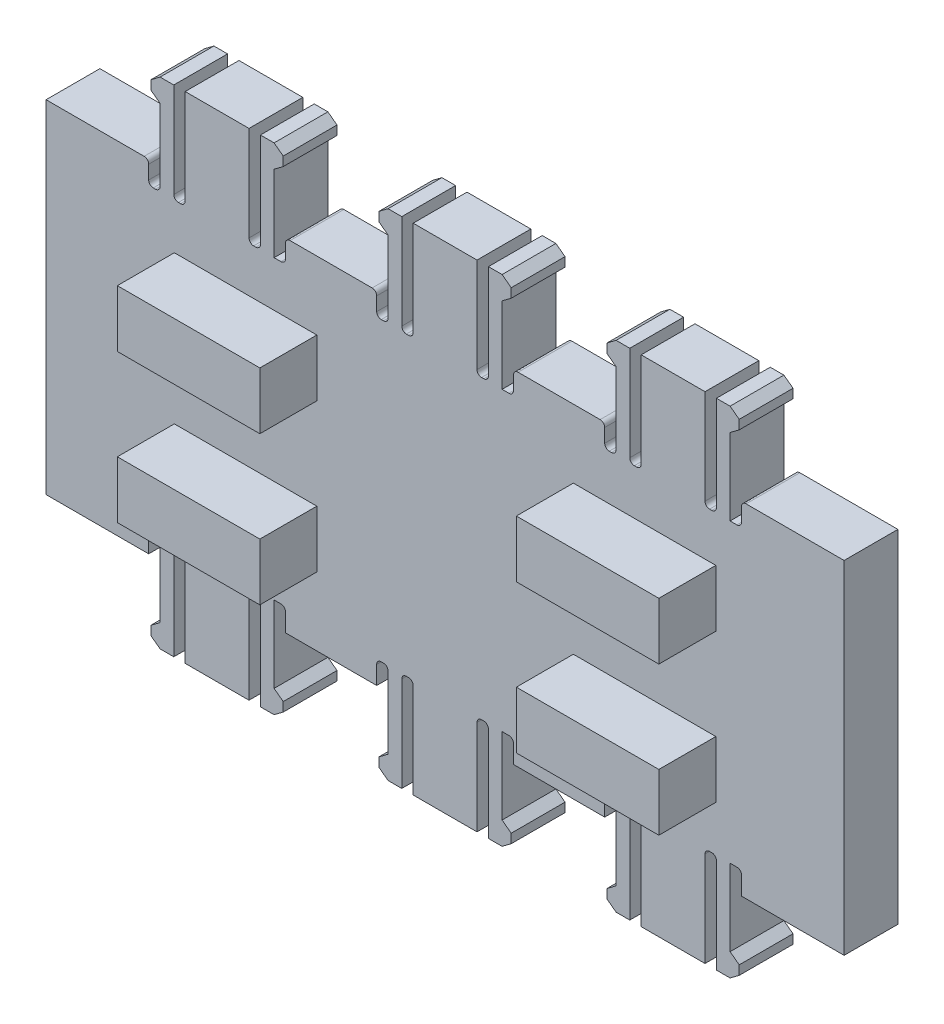
from build123d import *

# Parameters (mm, degrees)
SKETCH1_W                                    = 44.45
SKETCH1_H                                    = 19.05
BODY_DEPTH                                   = 2.9972
SKETCH2_W                                    = 6.35
SKETCH2_H                                    = 2.9972
TAB_DEPTH                                    = 4.2672
SKETCH3_W                                    = 0.635
SKETCH3_H                                    = 5.5372
SKETCH3_H_2                                  = 1.27
SLOTS_DEPTH                                  = 27.327905608
FILLET1_R                                    = 0.254
RETAINER_DEPTH                               = 2.9972
TAB_PATTERN_COUNT                            = 3
TAB_PATTERN_PITCH                            = 12.7
TAB_PATTERN_COPY_1_DEPTH                     = 2.9972
TAB_PATTERN_COPY_2_DEPTH                     = 2.9972
FILLET1_OF_TAB_PATTERN_R                     = 0.254
TAB_MIRROR_DEPTH                             = 2.9972
TAB_MIRROR_2_OUTLINE_W                       = 3.556
TAB_MIRROR_2_OUTLINE_H                       = 4.2672
TAB_MIRROR_2_DEPTH                           = 2.9972
SKETCH7_W                                    = 7.9375
SKETCH7_H                                    = 3.175
BOSS_DEPTH                                   = 3.175
BOSS_MIRROR_AT_THE_SECOND_PLANE_COPY_1_S_W   = 7.9375
BOSS_MIRROR_AT_THE_SECOND_PLANE_COPY_1_S_H   = 3.175
BOSS_MIRROR_AT_THE_SECOND_PLANE_COPY_1_DEPTH = 3.175


# Read off the part's stored shape, not the designer's step: Tab Mirror
with BuildPart() as part:
    # Sketch1 → Body (new body)
    with BuildSketch(Plane.XY):
        Rectangle(SKETCH1_W, SKETCH1_H)
    extrude(amount=BODY_DEPTH)

    # Sketch2 → Tab (add)
    with BuildSketch(Plane(origin=(0, 9.525, 0), x_dir=(1, 0, 0), z_dir=(0, 1, 0))):
        with Locations((-12.7, -1.4986)):
            Rectangle(SKETCH2_W, SKETCH2_H)
    tab = extrude(amount=TAB_DEPTH)

    # Sketch3 → Slots (cut, through all)
    with BuildSketch(Plane.XY.offset(2.9972)):
        with Locations((-14.7955, 11.0236)):
            Rectangle(SKETCH3_W, SKETCH3_H)
        with Locations((-10.6045, 11.0236)):
            Rectangle(SKETCH3_W, SKETCH3_H)
        with Locations((-9.2075, 8.89)):
            Rectangle(SKETCH3_W, SKETCH3_H_2)
        with Locations((-16.1925, 8.89)):
            Rectangle(SKETCH3_W, SKETCH3_H_2)
    slots = extrude(amount=-SLOTS_DEPTH, mode=Mode.SUBTRACT)

    # Fillet1
    fillet1_edges = [part.edges().sort_by_distance(p)[0] for p in [
        (-15.875, 8.255, 1.4986),
        (-16.51, 8.255, 1.4986),
        (-16.51, 9.525, 1.4986),
        (-8.89, 9.525, 1.4986),
        (-8.89, 8.255, 1.4986),
        (-10.287, 8.255, 1.4986),
        (-10.922, 8.255, 1.4986),
        (-14.478, 8.255, 1.4986),
        (-15.113, 8.255, 1.4986),
    ]]
    fillet(fillet1_edges, radius=FILLET1_R)

    # Sketch5 → Retainer (add)
    with BuildSketch(Plane.XY.offset(2.9972)):
        Polygon((-15.875, 13.7922), (-16.383, 13.4112), (-16.383, 12.9032), (-15.875, 12.5222), align=None)
    retainer = extrude(amount=-RETAINER_DEPTH)

    # Retainer Mirror: Retainer across plane
    add(retainer.mirror(Plane.ZY.offset(12.7)))

    # Tab Pattern: Tab, Slots, Retainer ×3
    with Locations(*[(i * TAB_PATTERN_PITCH, 0, 0) for i in range(1, TAB_PATTERN_COUNT)]):
        add(tab)
        add(slots, mode=Mode.SUBTRACT)
        add(retainer)

    # Tab Pattern copy 1 sketch → Tab Pattern copy 1 (add)
    with BuildSketch(Plane(origin=(-12.7, 0, 2.9972), x_dir=(-1, 0, 0), z_dir=(0, 0, 1))):
        Polygon((-15.875, -13.7922), (-16.383, -13.4112), (-16.383, -12.9032), (-15.875, -12.5222), align=None)
    extrude(amount=-TAB_PATTERN_COPY_1_DEPTH)

    # Tab Pattern copy 2 sketch → Tab Pattern copy 2 (add)
    with BuildSketch(Plane(origin=(0, 0, 2.9972), x_dir=(-1, 0, 0), z_dir=(0, 0, 1))):
        Polygon((-15.875, -13.7922), (-16.383, -13.4112), (-16.383, -12.9032), (-15.875, -12.5222), align=None)
    extrude(amount=-TAB_PATTERN_COPY_2_DEPTH)

    # Fillet1 of Tab Pattern
    fillet1_of_tab_pattern_edges = [part.edges().sort_by_distance(p)[0] for p in [
        (-3.175, 8.255, 1.4986),
        (-3.81, 8.255, 1.4986),
        (-3.81, 9.525, 1.4986),
        (3.81, 9.525, 1.4986),
        (3.81, 8.255, 1.4986),
        (2.413, 8.255, 1.4986),
        (1.778, 8.255, 1.4986),
        (-1.778, 8.255, 1.4986),
        (-2.413, 8.255, 1.4986),
        (9.525, 8.255, 1.4986),
        (8.89, 8.255, 1.4986),
        (8.89, 9.525, 1.4986),
        (16.51, 9.525, 1.4986),
        (16.51, 8.255, 1.4986),
        (15.113, 8.255, 1.4986),
        (14.478, 8.255, 1.4986),
        (10.922, 8.255, 1.4986),
        (10.287, 8.255, 1.4986),
    ]]
    fillet(fillet1_of_tab_pattern_edges, radius=FILLET1_OF_TAB_PATTERN_R)

    # Tab Mirror outline → Tab Mirror (cut)
    with BuildSketch(Plane.XY):
        with BuildLine():
            Line((15.875, -8.255), (15.875, -9.525))
            Line((15.875, -9.525), (16.51, -9.525))
            Line((16.51, -9.525), (16.51, -8.509))
            ThreePointArc((16.51, -8.509), (16.435605122, -8.329394878), (16.256, -8.255))
            Line((16.256, -8.255), (15.875, -8.255))
        make_face()
        with BuildLine():
            Line((14.478, -8.509), (14.478, -9.525))
            Line((14.478, -9.525), (15.113, -9.525))
            Line((15.113, -9.525), (15.113, -8.509))
            ThreePointArc((15.113, -8.509), (15.038605122, -8.329394878), (14.859, -8.255))
            Line((14.859, -8.255), (14.732, -8.255))
            ThreePointArc((14.732, -8.255), (14.552394878, -8.329394878), (14.478, -8.509))
        make_face()
        with BuildLine():
            Line((10.287, -8.509), (10.287, -9.525))
            Line((10.287, -9.525), (10.922, -9.525))
            Line((10.922, -9.525), (10.922, -8.509))
            ThreePointArc((10.922, -8.509), (10.847605122, -8.329394878), (10.668, -8.255))
            Line((10.668, -8.255), (10.541, -8.255))
            ThreePointArc((10.541, -8.255), (10.361394878, -8.329394878), (10.287, -8.509))
        make_face()
        with BuildLine():
            Line((-16.51, -9.525), (-15.875, -9.525))
            Line((-15.875, -9.525), (-15.875, -8.509))
            ThreePointArc((-15.875, -8.509), (-15.949394878, -8.329394878), (-16.129, -8.255))
            Line((-16.129, -8.255), (-16.256, -8.255))
            ThreePointArc((-16.256, -8.255), (-16.435605122, -8.329394878), (-16.51, -8.509))
            Line((-16.51, -8.509), (-16.51, -9.525))
        make_face()
        with BuildLine():
            Line((-15.113, -9.525), (-14.478, -9.525))
            Line((-14.478, -9.525), (-14.478, -8.509))
            ThreePointArc((-14.478, -8.509), (-14.552394878, -8.329394878), (-14.732, -8.255))
            Line((-14.732, -8.255), (-14.859, -8.255))
            ThreePointArc((-14.859, -8.255), (-15.038605122, -8.329394878), (-15.113, -8.509))
            Line((-15.113, -8.509), (-15.113, -9.525))
        make_face()
        with BuildLine():
            Line((-10.922, -9.525), (-10.287, -9.525))
            Line((-10.287, -9.525), (-10.287, -8.509))
            ThreePointArc((-10.287, -8.509), (-10.361394878, -8.329394878), (-10.541, -8.255))
            Line((-10.541, -8.255), (-10.668, -8.255))
            ThreePointArc((-10.668, -8.255), (-10.847605122, -8.329394878), (-10.922, -8.509))
            Line((-10.922, -8.509), (-10.922, -9.525))
        make_face()
        with BuildLine():
            Line((-9.525, -9.525), (-8.89, -9.525))
            Line((-8.89, -9.525), (-8.89, -8.509))
            ThreePointArc((-8.89, -8.509), (-8.964394878, -8.329394878), (-9.144, -8.255))
            Line((-9.144, -8.255), (-9.525, -8.255))
            Line((-9.525, -8.255), (-9.525, -9.525))
        make_face()
        with BuildLine():
            Line((-3.81, -9.525), (-3.175, -9.525))
            Line((-3.175, -9.525), (-3.175, -8.509))
            ThreePointArc((-3.175, -8.509), (-3.249394878, -8.329394878), (-3.429, -8.255))
            Line((-3.429, -8.255), (-3.556, -8.255))
            ThreePointArc((-3.556, -8.255), (-3.735605122, -8.329394878), (-3.81, -8.509))
            Line((-3.81, -8.509), (-3.81, -9.525))
        make_face()
        with BuildLine():
            Line((-2.413, -9.525), (-1.778, -9.525))
            Line((-1.778, -9.525), (-1.778, -8.509))
            ThreePointArc((-1.778, -8.509), (-1.852394878, -8.329394878), (-2.032, -8.255))
            Line((-2.032, -8.255), (-2.159, -8.255))
            ThreePointArc((-2.159, -8.255), (-2.338605122, -8.329394878), (-2.413, -8.509))
            Line((-2.413, -8.509), (-2.413, -9.525))
        make_face()
        with BuildLine():
            Line((1.778, -9.525), (2.413, -9.525))
            Line((2.413, -9.525), (2.413, -8.509))
            ThreePointArc((2.413, -8.509), (2.338605122, -8.329394878), (2.159, -8.255))
            Line((2.159, -8.255), (2.032, -8.255))
            ThreePointArc((2.032, -8.255), (1.852394878, -8.329394878), (1.778, -8.509))
            Line((1.778, -8.509), (1.778, -9.525))
        make_face()
        with BuildLine():
            Line((3.175, -9.525), (3.81, -9.525))
            Line((3.81, -9.525), (3.81, -8.509))
            ThreePointArc((3.81, -8.509), (3.735605122, -8.329394878), (3.556, -8.255))
            Line((3.556, -8.255), (3.175, -8.255))
            Line((3.175, -8.255), (3.175, -9.525))
        make_face()
        with BuildLine():
            Line((9.525, -9.525), (9.525, -8.509))
            ThreePointArc((9.525, -8.509), (9.450605122, -8.329394878), (9.271, -8.255))
            Line((9.271, -8.255), (9.144, -8.255))
            ThreePointArc((9.144, -8.255), (8.964394878, -8.329394878), (8.89, -8.509))
            Line((8.89, -8.509), (8.89, -9.525))
            Line((8.89, -9.525), (9.525, -9.525))
        make_face()
    extrude(amount=TAB_MIRROR_DEPTH, mode=Mode.SUBTRACT)

    # Tab Mirror 2 outline → Tab Mirror 2 (add)
    with BuildSketch(Plane.XY):
        Polygon((15.875, -9.525), (15.113, -9.525), (15.113, -13.7922), (15.875, -13.7922), (16.383, -13.4112), (16.383, -12.9032), (15.875, -12.5222), align=None)
        with Locations((12.7, -11.6586)):
            Rectangle(TAB_MIRROR_2_OUTLINE_W, TAB_MIRROR_2_OUTLINE_H)
        Polygon((10.287, -9.525), (9.525, -9.525), (9.525, -12.5222), (9.017, -12.9032), (9.017, -13.4112), (9.525, -13.7922), (10.287, -13.7922), align=None)
        Polygon((-15.113, -13.7922), (-15.113, -9.525), (-15.875, -9.525), (-15.875, -12.5222), (-16.383, -12.9032), (-16.383, -13.4112), (-15.875, -13.7922), align=None)
        with Locations((-12.7, -11.6586)):
            Rectangle(TAB_MIRROR_2_OUTLINE_W, TAB_MIRROR_2_OUTLINE_H)
        Polygon((-9.525, -12.5222), (-9.525, -9.525), (-10.287, -9.525), (-10.287, -13.7922), (-9.525, -13.7922), (-9.017, -13.4112), (-9.017, -12.9032), align=None)
        Polygon((-2.413, -13.7922), (-2.413, -9.525), (-3.175, -9.525), (-3.175, -12.5222), (-3.683, -12.9032), (-3.683, -13.4112), (-3.175, -13.7922), align=None)
        with Locations((0, -11.6586)):
            Rectangle(TAB_MIRROR_2_OUTLINE_W, TAB_MIRROR_2_OUTLINE_H)
        Polygon((3.175, -12.5222), (3.175, -9.525), (2.413, -9.525), (2.413, -13.7922), (3.175, -13.7922), (3.683, -13.4112), (3.683, -12.9032), align=None)
    extrude(amount=TAB_MIRROR_2_DEPTH)

    # Sketch7 → Boss (add)
    with BuildSketch(Plane.XY.offset(2.9972)):
        with Locations((-11.1125, 4.1275)):
            Rectangle(SKETCH7_W, SKETCH7_H)
    boss = extrude(amount=BOSS_DEPTH)

    # Boss Mirror: Boss across plane
    add(boss.mirror(Plane.ZX))

    # Boss Mirror at the second plane: Boss across plane
    add(boss.mirror(Plane.ZY))

    # Boss Mirror at the second plane copy 1 s → Boss Mirror at the second plane copy 1 (add)
    with BuildSketch(Plane(origin=(0, 0, 2.9972), x_dir=(-1, 0, 0), z_dir=(0, 0, 1))):
        with Locations((-11.1125, 4.1275)):
            Rectangle(BOSS_MIRROR_AT_THE_SECOND_PLANE_COPY_1_S_W, BOSS_MIRROR_AT_THE_SECOND_PLANE_COPY_1_S_H)
    extrude(amount=BOSS_MIRROR_AT_THE_SECOND_PLANE_COPY_1_DEPTH)


solid = part.part
